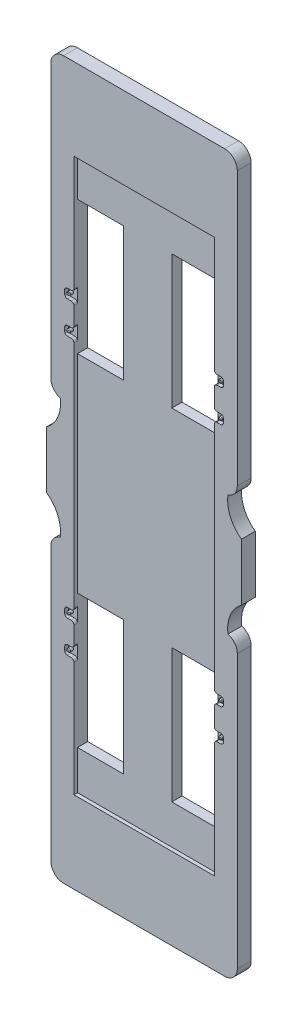
from build123d import *

# Parameters (mm, degrees)
BOSS_EXTRUDE1_OUTLINE_W = 20
BOSS_EXTRUDE1_OUTLINE_H = 58
BOSS_EXTRUDE1_DEPTH     = 4.43
SKETCH1_3_R             = 0.75
BOSS_EXTRUDE2_DEPTH     = 6
FILLET1_R               = 0.3


# Read off the part's stored shape, not the designer's step: Boss-Extrude1
with BuildPart() as part:
    # Boss-Extrude1 outline → Boss-Extrude1 (new body)
    with BuildSketch(Plane.XY.offset(0.1)):
        with BuildLine():
            ThreePointArc((-40.45, 31.485659466), (-39.318743113, 28.144389705), (-36.390333232, 26.177605191))
            ThreePointArc((-36.390333232, 26.177605191), (-37.409307611, 18.483960793), (-42.25, 12.417811265))
            Line((-42.25, 12.417811265), (-42.25, -12.417811265))
            ThreePointArc((-42.25, -12.417811265), (-37.409307611, -18.483960793), (-36.390333232, -26.177605191))
            ThreePointArc((-36.390333232, -26.177605191), (-39.318743113, -28.144389705), (-40.45, -31.485659466))
            Line((-40.45, -31.485659466), (-40.45, -150))
            ThreePointArc((-40.45, -150), (-38.839087297, -153.889087297), (-34.95, -155.5))
            Line((-34.95, -155.5), (34.95, -155.5))
            ThreePointArc((34.95, -155.5), (38.839087297, -153.889087297), (40.45, -150))
            Line((40.45, -150), (40.45, -31.485659466))
            ThreePointArc((40.45, -31.485659466), (39.318743113, -28.144389705), (36.390333232, -26.177605191))
            ThreePointArc((36.390333232, -26.177605191), (37.409307611, -18.483960793), (42.25, -12.417811265))
            Line((42.25, -12.417811265), (42.25, 12.417811265))
            ThreePointArc((42.25, 12.417811265), (37.409307611, 18.483960793), (36.390333232, 26.177605191))
            ThreePointArc((36.390333232, 26.177605191), (39.318743113, 28.144389705), (40.45, 31.485659466))
            Line((40.45, 31.485659466), (40.45, 150))
            ThreePointArc((40.45, 150), (38.839087297, 153.889087297), (34.95, 155.5))
            Line((34.95, 155.5), (-34.95, 155.5))
            ThreePointArc((-34.95, 155.5), (-38.839087297, 153.889087297), (-40.45, 150))
            Line((-40.45, 150), (-40.45, 31.485659466))
        make_face()
        with Locations((-20.45, -74)):
            Rectangle(BOSS_EXTRUDE1_OUTLINE_W, BOSS_EXTRUDE1_OUTLINE_H, mode=Mode.SUBTRACT)
        with Locations((20.45, -74)):
            Rectangle(BOSS_EXTRUDE1_OUTLINE_W, BOSS_EXTRUDE1_OUTLINE_H, mode=Mode.SUBTRACT)
        with Locations((-20.45, 74)):
            Rectangle(BOSS_EXTRUDE1_OUTLINE_W, BOSS_EXTRUDE1_OUTLINE_H, mode=Mode.SUBTRACT)
        with Locations((20.45, 74)):
            Rectangle(BOSS_EXTRUDE1_OUTLINE_W, BOSS_EXTRUDE1_OUTLINE_H, mode=Mode.SUBTRACT)
    extrude(amount=BOSS_EXTRUDE1_DEPTH)

    # Sketch1<3> → Boss-Extrude2 (add)
    # profile 1 of 9: a face of its own
    with BuildSketch(Plane.XY.offset(0.1)):
        with BuildLine():
            ThreePointArc((36.390333232, 26.177605191), (39.318743113, 28.144389705), (40.45, 31.485659466))
            Line((40.45, 31.485659466), (40.45, 150))
            ThreePointArc((40.45, 150), (38.839087297, 153.889087297), (34.95, 155.5))
            Line((34.95, 155.5), (-34.95, 155.5))
            ThreePointArc((-34.95, 155.5), (-38.839087297, 153.889087297), (-40.45, 150))
            Line((-40.45, 150), (-40.45, 31.485659466))
            ThreePointArc((-40.45, 31.485659466), (-39.318743113, 28.144389705), (-36.390333232, 26.177605191))
            ThreePointArc((-36.390333232, 26.177605191), (-37.409307611, 18.483960794), (-42.25, 12.417811265))
            Line((-42.25, 12.417811265), (-42.25, -12.417811265))
            ThreePointArc((-42.25, -12.417811265), (-37.409307611, -18.483960794), (-36.390333232, -26.177605191))
            ThreePointArc((-36.390333232, -26.177605191), (-39.318743113, -28.144389705), (-40.45, -31.485659466))
            Line((-40.45, -31.485659466), (-40.45, -150))
            ThreePointArc((-40.45, -150), (-38.839087297, -153.889087297), (-34.95, -155.5))
            Line((-34.95, -155.5), (34.95, -155.5))
            ThreePointArc((34.95, -155.5), (38.839087297, -153.889087297), (40.45, -150))
            Line((40.45, -150), (40.45, -31.485659466))
            ThreePointArc((40.45, -31.485659466), (39.318743113, -28.144389705), (36.390333232, -26.177605191))
            ThreePointArc((36.390333232, -26.177605191), (37.409307611, -18.483960794), (42.25, -12.417811265))
            Line((42.25, -12.417811265), (42.25, 12.417811265))
            ThreePointArc((42.25, 12.417811265), (37.409307611, 18.483960794), (36.390333232, 26.177605191))
        make_face()
        with BuildLine():
            Line((-30.45, 70.2), (-30.45, 120))
            Line((-30.45, 120), (30.45, 120))
            Line((30.45, 120), (30.45, 70.2))
            ThreePointArc((30.45, 70.2), (30.801471863, 69.351471863), (31.65, 69))
            Line((31.65, 69), (33.25, 69))
            ThreePointArc((33.25, 69), (34.098528137, 68.648528137), (34.45, 67.8))
            Line((34.45, 67.8), (34.45, 66.2))
            ThreePointArc((34.45, 66.2), (34.098528137, 65.351471863), (33.25, 65))
            Line((33.25, 65), (31.65, 65))
            ThreePointArc((31.65, 65), (30.801471863, 64.648528137), (30.45, 63.8))
            Line((30.45, 63.8), (30.45, 56.2))
            ThreePointArc((30.45, 56.2), (30.801471863, 55.351471863), (31.65, 55))
            Line((31.65, 55), (33.25, 55))
            ThreePointArc((33.25, 55), (34.098528137, 54.648528137), (34.45, 53.8))
            Line((34.45, 53.8), (34.45, 52.2))
            ThreePointArc((34.45, 52.2), (34.098528137, 51.351471863), (33.25, 51))
            Line((33.25, 51), (31.65, 51))
            ThreePointArc((31.65, 51), (30.801471863, 50.648528137), (30.45, 49.8))
            Line((30.45, 49.8), (30.45, 0))
            Line((30.45, 0), (30.45, -49.8))
            ThreePointArc((30.45, -49.8), (30.801471863, -50.648528137), (31.65, -51))
            Line((31.65, -51), (33.25, -51))
            ThreePointArc((33.25, -51), (34.098528137, -51.351471863), (34.45, -52.2))
            Line((34.45, -52.2), (34.45, -53.8))
            ThreePointArc((34.45, -53.8), (34.098528137, -54.648528137), (33.25, -55))
            Line((33.25, -55), (31.65, -55))
            ThreePointArc((31.65, -55), (30.801471863, -55.351471863), (30.45, -56.2))
            Line((30.45, -56.2), (30.45, -63.8))
            ThreePointArc((30.45, -63.8), (30.801471863, -64.648528137), (31.65, -65))
            Line((31.65, -65), (33.25, -65))
            ThreePointArc((33.25, -65), (34.098528137, -65.351471863), (34.45, -66.2))
            Line((34.45, -66.2), (34.45, -67.8))
            ThreePointArc((34.45, -67.8), (34.098528137, -68.648528137), (33.25, -69))
            Line((33.25, -69), (31.65, -69))
            ThreePointArc((31.65, -69), (30.801471863, -69.351471863), (30.45, -70.2))
            Line((30.45, -70.2), (30.45, -120))
            Line((30.45, -120), (-30.45, -120))
            Line((-30.45, -120), (-30.45, -70.2))
            ThreePointArc((-30.45, -70.2), (-30.801471863, -69.351471863), (-31.65, -69))
            Line((-31.65, -69), (-33.25, -69))
            ThreePointArc((-33.25, -69), (-34.098528137, -68.648528137), (-34.45, -67.8))
            Line((-34.45, -67.8), (-34.45, -66.2))
            ThreePointArc((-34.45, -66.2), (-34.098528137, -65.351471863), (-33.25, -65))
            Line((-33.25, -65), (-31.65, -65))
            ThreePointArc((-31.65, -65), (-30.801471863, -64.648528137), (-30.45, -63.8))
            Line((-30.45, -63.8), (-30.45, -56.2))
            ThreePointArc((-30.45, -56.2), (-30.801471863, -55.351471863), (-31.65, -55))
            Line((-31.65, -55), (-33.25, -55))
            ThreePointArc((-33.25, -55), (-34.098528137, -54.648528137), (-34.45, -53.8))
            Line((-34.45, -53.8), (-34.45, -52.2))
            ThreePointArc((-34.45, -52.2), (-34.098528137, -51.351471863), (-33.25, -51))
            Line((-33.25, -51), (-31.65, -51))
            ThreePointArc((-31.65, -51), (-30.801471863, -50.648528137), (-30.45, -49.8))
            Line((-30.45, -49.8), (-30.45, 0))
            Line((-30.45, 0), (-30.45, 49.8))
            ThreePointArc((-30.45, 49.8), (-30.801471863, 50.648528137), (-31.65, 51))
            Line((-31.65, 51), (-33.25, 51))
            ThreePointArc((-33.25, 51), (-34.098528137, 51.351471863), (-34.45, 52.2))
            Line((-34.45, 52.2), (-34.45, 53.8))
            ThreePointArc((-34.45, 53.8), (-34.098528137, 54.648528137), (-33.25, 55))
            Line((-33.25, 55), (-31.65, 55))
            ThreePointArc((-31.65, 55), (-30.801471863, 55.351471863), (-30.45, 56.2))
            Line((-30.45, 56.2), (-30.45, 63.8))
            ThreePointArc((-30.45, 63.8), (-30.801471863, 64.648528137), (-31.65, 65))
            Line((-31.65, 65), (-33.25, 65))
            ThreePointArc((-33.25, 65), (-34.098528137, 65.351471863), (-34.45, 66.2))
            Line((-34.45, 66.2), (-34.45, 67.8))
            ThreePointArc((-34.45, 67.8), (-34.098528137, 68.648528137), (-33.25, 69))
            Line((-33.25, 69), (-31.65, 69))
            ThreePointArc((-31.65, 69), (-30.801471863, 69.351471863), (-30.45, 70.2))
        make_face(mode=Mode.SUBTRACT)
    # profile 2 of 9: a face of its own
    with BuildSketch(Plane.XY.offset(0.1)):
        with Locations(Location((-32.95, -67, 0), (0, 0, 180))):
            Circle(SKETCH1_3_R)
    # profile 3 of 9: a face of its own
    with BuildSketch(Plane.XY.offset(0.1)):
        with Locations(Location((-32.95, -53, 0), (0, 0, 180))):
            Circle(SKETCH1_3_R)
    # profile 4 of 9: a face of its own
    with BuildSketch(Plane.XY.offset(0.1)):
        with Locations(Location((32.95, -67, 0), (0, 0, 180))):
            Circle(SKETCH1_3_R)
    # profile 5 of 9: a face of its own
    with BuildSketch(Plane.XY.offset(0.1)):
        with Locations(Location((32.95, -53, 0), (0, 0, 180))):
            Circle(SKETCH1_3_R)
    # profile 6 of 9: a face of its own
    with BuildSketch(Plane.XY.offset(0.1)):
        with Locations(Location((32.95, 53, 0), (0, 0, 180))):
            Circle(SKETCH1_3_R)
    # profile 7 of 9: a face of its own
    with BuildSketch(Plane.XY.offset(0.1)):
        with Locations(Location((32.95, 67, 0), (0, 0, 180))):
            Circle(SKETCH1_3_R)
    # profile 8 of 9: a face of its own
    with BuildSketch(Plane.XY.offset(0.1)):
        with Locations(Location((-32.95, 53, 0), (0, 0, 180))):
            Circle(SKETCH1_3_R)
    # profile 9 of 9: a face of its own
    with BuildSketch(Plane.XY.offset(0.1)):
        with Locations(Location((-32.95, 67, 0), (0, 0, 180))):
            Circle(SKETCH1_3_R)
    extrude(amount=BOSS_EXTRUDE2_DEPTH)

    # Fillet1
    fillet1_edges = [part.edges().sort_by_distance(p)[0] for p in [
        (-32.2, 67, 6.1),
        (-32.2, 53, 6.1),
        (33.7, 67, 6.1),
        (33.7, 53, 6.1),
        (-32.2, -53, 6.1),
        (-32.2, -67, 6.1),
        (33.7, -53, 6.1),
        (33.7, -67, 6.1),
    ]]
    fillet(fillet1_edges, radius=FILLET1_R)


solid = part.part
